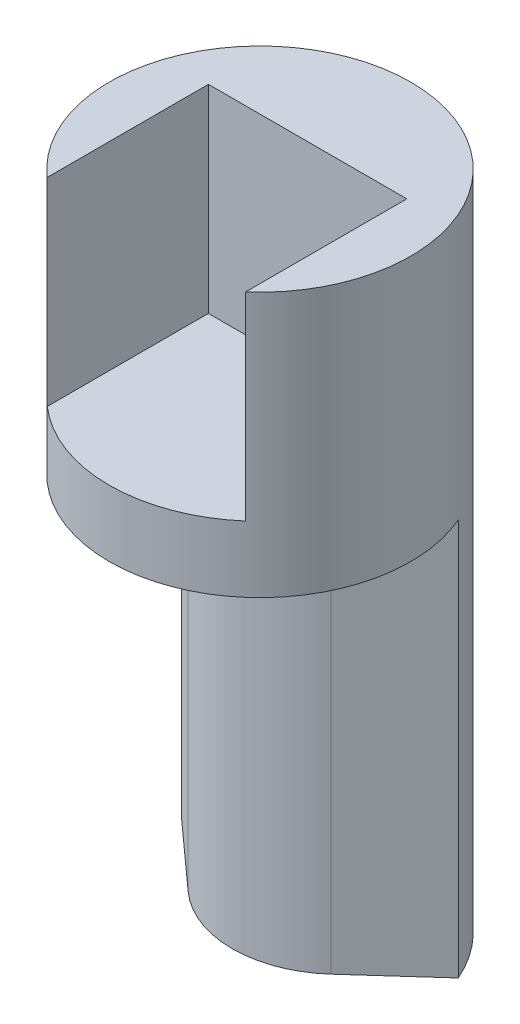
from build123d import *

# Parameters (mm, degrees)
SKETCH2_R                = 14.478
BOSS_EXTRUDE1_DEPTH      = 50.8
CUT_EXTRUDE3_DEPTH       = 38.1
BOSS_EXTRUDE2_DEPTH      = 12.7
BOSS_EXTRUDE2_DEPTH_BACK = 12.7
SKETCH16_R               = 14.478
SKETCH17_W               = 19.05
SKETCH17_H               = 19.05
CUT_EXTRUDE4_DEPTH       = 19.05


with BuildPart() as part:
    # Sketch2 → Boss-Extrude1 (new body)
    with BuildSketch(Plane(origin=(0, 0, 0), x_dir=(1, 0, 0), z_dir=(0, 1, 0))):
        Circle(SKETCH2_R)
        with BuildLine():
            Line((-13.081, 3.175), (-8.059107313, -1.349826056))
            ThreePointArc((-8.059107313, -1.349826056), (0, -4.445), (8.059107313, -1.349826056))
            Line((8.059107313, -1.349826056), (13.081, 3.175))
            ThreePointArc((13.081, 3.175), (13.146371637, 4.430535164), (11.890836473, 4.495906802))
            Line((11.890836473, 4.495906802), (6.868943786, -0.028919255))
            ThreePointArc((6.868943786, -0.028919255), (0, -2.667), (-6.868943786, -0.028919255))
            Line((-6.868943786, -0.028919255), (-11.890836473, 4.495906802))
            ThreePointArc((-11.890836473, 4.495906802), (-13.146371637, 4.430535164), (-13.081, 3.175))
        make_face(mode=Mode.SUBTRACT)
    extrude(amount=BOSS_EXTRUDE1_DEPTH)

    # Sketch15 → Cut-Extrude3 (cut)
    with BuildSketch(Plane.XZ):
        with BuildLine():
            ThreePointArc((13.081, -3.175), (13.146371637, -4.430535164), (11.890836473, -4.495906802))
            Line((11.890836473, -4.495906802), (13.285944291, -5.752926933))
            ThreePointArc((13.285944291, -5.752926933), (14.176854119, -2.937565536), (14.478, 0))
            ThreePointArc((14.478, 0), (-2.937565536, 14.176854119), (-13.285944291, -5.752926933))
            Line((-13.285944291, -5.752926933), (-11.890836473, -4.495906802))
            ThreePointArc((-11.890836473, -4.495906802), (-13.146371637, -4.430535164), (-13.081, -3.175))
            Line((-13.081, -3.175), (-8.059107313, 1.349826056))
            ThreePointArc((-8.059107313, 1.349826056), (0, 4.445), (8.059107313, 1.349826056))
            Line((8.059107313, 1.349826056), (13.081, -3.175))
        make_face()
    extrude(amount=-CUT_EXTRUDE3_DEPTH, mode=Mode.SUBTRACT)

    # Sketch16 → Boss-Extrude2 (add, two sides: drawn at the far end of the back side and taken through both)
    with BuildSketch(Plane(origin=(0, 50.8, 0), x_dir=(1, 0, 0), z_dir=(0, 1, 0)).offset(-BOSS_EXTRUDE2_DEPTH_BACK)):
        Circle(SKETCH16_R)
    extrude(amount=BOSS_EXTRUDE2_DEPTH + BOSS_EXTRUDE2_DEPTH_BACK)

    # Sketch17 → Cut-Extrude4 (cut)
    with BuildSketch(Plane(origin=(0, 63.5, 0), x_dir=(1, 0, 0), z_dir=(0, 1, 0))):
        with Locations((0, -4.953)):
            Rectangle(SKETCH17_W, SKETCH17_H)
    extrude(amount=-CUT_EXTRUDE4_DEPTH, mode=Mode.SUBTRACT)


solid = part.part
